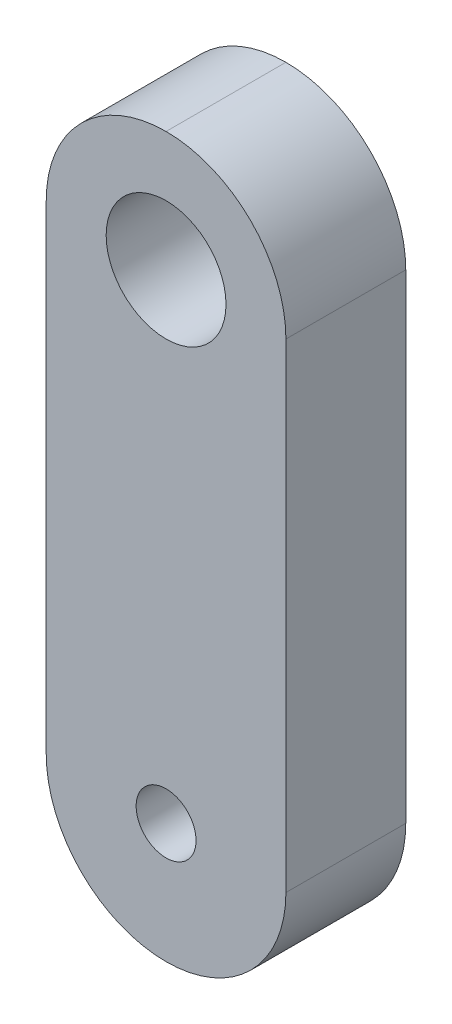
from build123d import *

# Parameters (mm, degrees)
ESQUISSE1_W                  = 20
ESQUISSE1_H                  = 60
BOSS_EXTRU_1_DEPTH           = 10
ENL_V_MAT_EXTRU_1_DEPTH      = 65.031242374
ENL_V_MAT_EXTRU_1_DEPTH_BACK = 65.031242374
ESQUISSE2_R                  = 5
ESQUISSE2_R_2                = 2.5
CONG_1_R                     = 10


with BuildPart() as part:
    # Esquisse1 → Boss.-Extru.1 (new body)
    with BuildSketch(Plane.XY):
        with Locations((10, 30)):
            Rectangle(ESQUISSE1_W, ESQUISSE1_H)
    extrude(amount=BOSS_EXTRU_1_DEPTH)

    # Esquisse2 → Enlèv. mat.-Extru.1 (cut, two sides: drawn at the far end of the back side and taken through both)
    with BuildSketch(Plane.XY.offset(10).offset(-ENL_V_MAT_EXTRU_1_DEPTH_BACK)):
        with Locations((10, 50)):
            Circle(ESQUISSE2_R)
        with Locations((10, 10)):
            Circle(ESQUISSE2_R_2)
    extrude(amount=ENL_V_MAT_EXTRU_1_DEPTH + ENL_V_MAT_EXTRU_1_DEPTH_BACK, mode=Mode.SUBTRACT)

    # Congé1
    cong_1_edges = [part.edges().sort_by_distance(p)[0] for p in [
        (0, 0, 5),
        (20, 0, 5),
        (0, 60, 5),
        (20, 60, 5),
    ]]
    fillet(cong_1_edges, radius=CONG_1_R - 0.0001)  # a hair under: the kernel refuses the full size


solid = part.part
